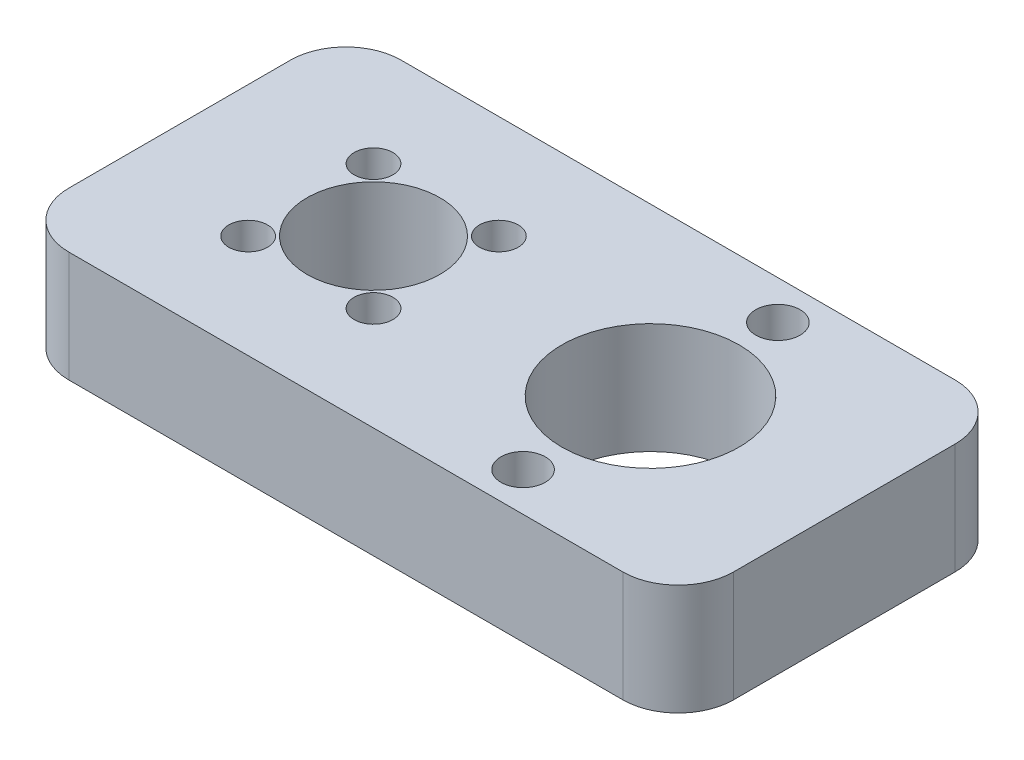
from build123d import *

# Parameters (mm, degrees)
SKETCH1_W           = 60
SKETCH1_H           = 30
SKETCH1_R           = 8
SKETCH1_R_2         = 6
SKETCH1_R_3         = 1.75
SKETCH1_R_4         = 2
BOSS_EXTRUDE1_DEPTH = 10
FILLET1_R           = 5


with BuildPart() as part:
    # Sketch1 → Boss-Extrude1 (new body)
    with BuildSketch(Plane(origin=(0, 0, 0), x_dir=(1, 0, 0), z_dir=(0, 1, 0))):
        Rectangle(SKETCH1_W, SKETCH1_H)
        with Locations((12.5, 0)):
            Circle(SKETCH1_R, mode=Mode.SUBTRACT)
        with Locations((-12.5, 0)):
            Circle(SKETCH1_R_2, mode=Mode.SUBTRACT)
        with Locations((-18.156854249, 5.656854249)):
            Circle(SKETCH1_R_3, mode=Mode.SUBTRACT)
        with Locations((-6.843145751, 5.656854249)):
            Circle(SKETCH1_R_3, mode=Mode.SUBTRACT)
        with Locations((-6.843145751, -5.656854249)):
            Circle(SKETCH1_R_3, mode=Mode.SUBTRACT)
        with Locations((-18.156854249, -5.656854249)):
            Circle(SKETCH1_R_3, mode=Mode.SUBTRACT)
        with Locations((12.5, -11.5)):
            Circle(SKETCH1_R_4, mode=Mode.SUBTRACT)
        with Locations((12.5, 11.5)):
            Circle(SKETCH1_R_4, mode=Mode.SUBTRACT)
    extrude(amount=BOSS_EXTRUDE1_DEPTH)

    # Fillet1
    fillet1_edges = [part.edges().sort_by_distance(p)[0] for p in [
        (30, 5, 15),
        (-30, 5, 15),
        (-30, 5, -15),
        (30, 5, -15),
    ]]
    fillet(fillet1_edges, radius=FILLET1_R)


solid = part.part
